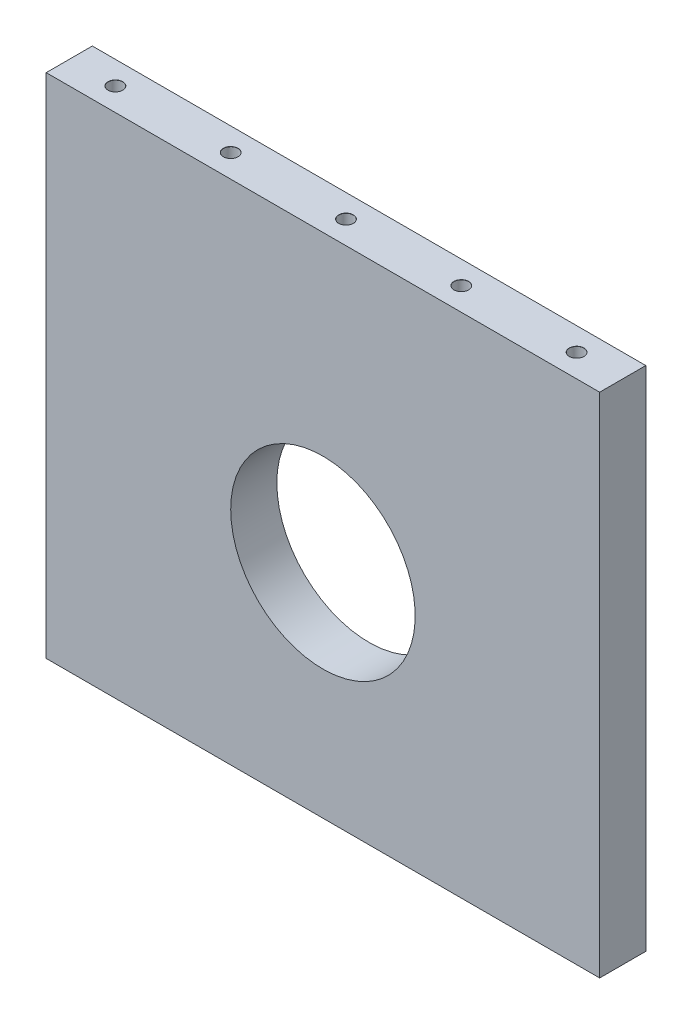
from build123d import *

# Parameters (mm, degrees)
SKETCH1_W                              = 120
SKETCH1_H                              = 110
BOSS_EXTRUDE1_DEPTH                    = 10
TAP_DRILL_FOR_M3_HELICOIL1_D           = 3.15
TAP_DRILL_FOR_M3_HELICOIL1_DEPTH       = 6
TAP_DRILL_FOR_M3_HELICOIL1_CSINK_D     = 3.2
TAP_DRILL_FOR_M3_HELICOIL1_CSINK_ANGLE = 90
TAP_DRILL_FOR_M3_HELICOIL1_TIP         = 0.946355475
F_40_0_40_DIAMETER_HOLE1_D             = 40


with BuildPart() as part:
    # Sketch1 → Boss-Extrude1 (new body)
    with BuildSketch(Plane.XY):
        with Locations((60, 55)):
            Rectangle(SKETCH1_W, SKETCH1_H)
    extrude(amount=BOSS_EXTRUDE1_DEPTH)

    # Tap Drill for M3 Helicoil1
    with Locations(Plane(origin=(0, 110, 0), x_dir=(1, 0, 0), z_dir=(0, 1, 0))):
        with Locations((10, -5), (60, -5), (85, -5), (110, -5), (35, -5)):
            CounterSinkHole(TAP_DRILL_FOR_M3_HELICOIL1_D / 2, TAP_DRILL_FOR_M3_HELICOIL1_CSINK_D / 2, depth=TAP_DRILL_FOR_M3_HELICOIL1_DEPTH, counter_sink_angle=TAP_DRILL_FOR_M3_HELICOIL1_CSINK_ANGLE)
            with Locations((0, 0, -(TAP_DRILL_FOR_M3_HELICOIL1_DEPTH + TAP_DRILL_FOR_M3_HELICOIL1_TIP / 2))):  # 118° drill point
                Cone(0, TAP_DRILL_FOR_M3_HELICOIL1_D / 2, TAP_DRILL_FOR_M3_HELICOIL1_TIP, mode=Mode.SUBTRACT)

    # Ø40.0 (40) Diameter Hole1 (through all)
    with Locations(Plane(origin=(0, 0, 0), x_dir=(-1, 0, 0), z_dir=(0, 0, -1))):
        with Locations((-60, 48)):
            Hole(F_40_0_40_DIAMETER_HOLE1_D / 2)


solid = part.part
